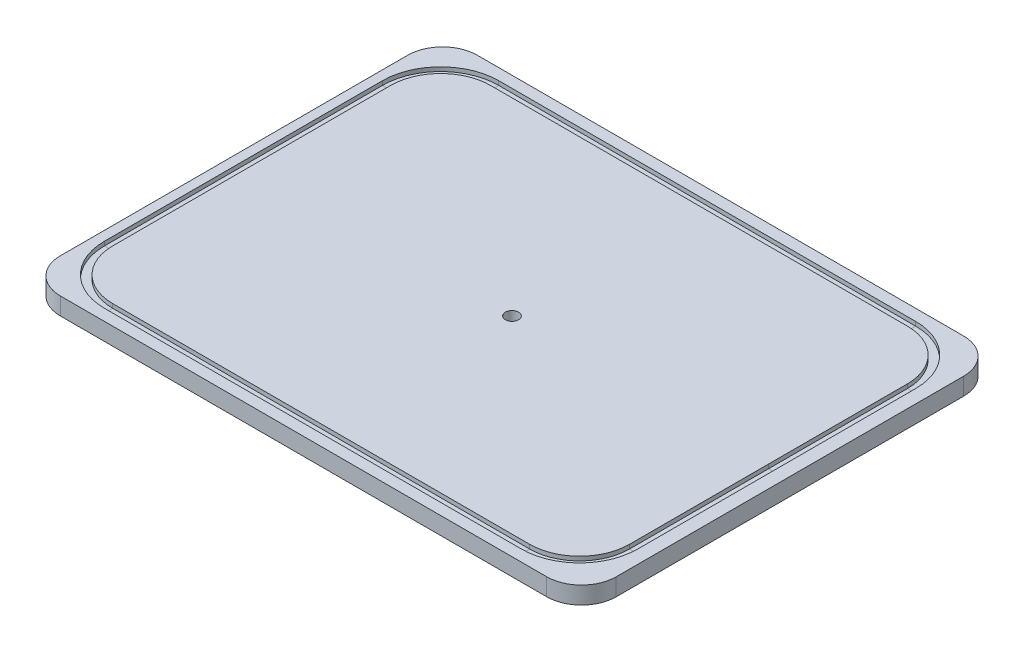
from build123d import *

# Parameters (mm, degrees)
MAIN_BODY_DEPTH        = 6.35
F_10_32_TAPPED_HOLE2_D = 4.826
GASKETPROFILE_W        = 3
GASKETPROFILE_H        = 3


with BuildPart() as part:
    # Sketch1 → main body (new body)
    with BuildSketch(Plane(origin=(0, 0, 0), x_dir=(1, 0, 0), z_dir=(0, 1, 0))):
        with BuildLine():
            Line((-101.6, 63.5), (-101.6, -63.5))
            ThreePointArc((-101.6, -63.5), (-97.880256121, -72.480256121), (-88.9, -76.2))
            Line((-88.9, -76.2), (88.9, -76.2))
            ThreePointArc((88.9, -76.2), (97.880256121, -72.480256121), (101.6, -63.5))
            Line((101.6, -63.5), (101.6, 63.5))
            ThreePointArc((101.6, 63.5), (97.880256121, 72.480256121), (88.9, 76.2))
            Line((88.9, 76.2), (-88.9, 76.2))
            ThreePointArc((-88.9, 76.2), (-97.880256121, 72.480256121), (-101.6, 63.5))
        make_face()
    extrude(amount=MAIN_BODY_DEPTH)

    # #10-32 Tapped Hole2 (through all)
    with Locations(Plane.XZ):
        with Locations((0, 0)):
            Hole(F_10_32_TAPPED_HOLE2_D / 2)

    # GasketInsert: sweep along a path in GasketPath
    with BuildLine(Plane(origin=(0, 6.35, 0), x_dir=(1, 0, 0), z_dir=(0, 1, 0))) as gasketinsert_path:
        Line((-95.6, 50.8), (-95.6, -50.8))
        ThreePointArc((-95.6, -50.8), (-90.122896808, -64.022896808), (-76.9, -69.5))
        Line((-76.9, -69.5), (75.5, -69.5))
        ThreePointArc((75.5, -69.5), (88.722896808, -64.022896808), (94.2, -50.8))
        Line((94.2, -50.8), (94.2, 50.8))
        ThreePointArc((94.2, 50.8), (88.722896808, 64.022896808), (75.5, 69.5))
        Line((75.5, 69.5), (-76.9, 69.5))
        ThreePointArc((-76.9, 69.5), (-90.122896808, 64.022896808), (-95.6, 50.8))
    # GasketProfile → GasketInsert (sweep, cut)
    with BuildSketch(Plane(origin=(0, 0, 0), x_dir=(-1, 0, 0), z_dir=(0, 0, -1))):
        with Locations((-95.25, 6.35)):
            Rectangle(GASKETPROFILE_W, GASKETPROFILE_H)
    sweep(path=gasketinsert_path.line, mode=Mode.SUBTRACT)


solid = part.part
